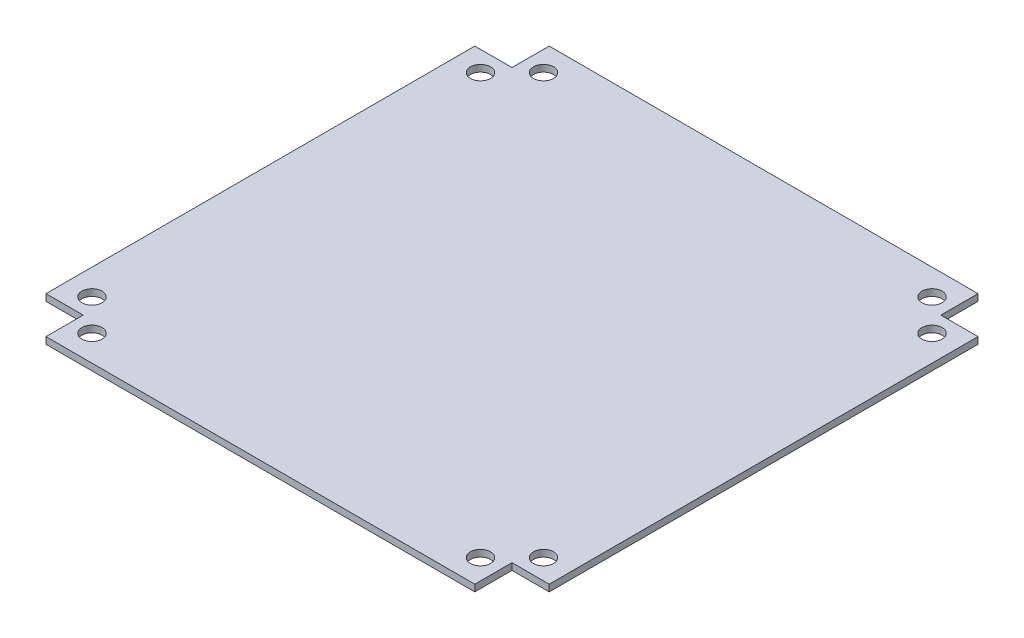
from build123d import *

# Parameters (mm, degrees)
BOSS_EXTRUDE1_DEPTH = 1.3
SKETCH2_R           = 1.95
CUT_EXTRUDE1_DEPTH  = 1.3


with BuildPart() as part:
    # Sketch1 → Boss-Extrude1 (new body)
    with BuildSketch(Plane(origin=(0, 0, 0), x_dir=(1, 0, 0), z_dir=(0, 1, 0))):
        Polygon((7.2, 7.2), (7.2, 0), (90.2, 0), (90.2, 7.2), (97.4, 7.2), (97.4, 90.2), (90.2, 90.2), (90.2, 97.4), (7.2, 97.4), (7.2, 90.2), (0, 90.2), (0, 7.2), align=None)
    extrude(amount=BOSS_EXTRUDE1_DEPTH)

    # Sketch2 → Cut-Extrude1 (cut)
    with BuildSketch(Plane.XZ):
        with Locations((92.4, -86.3)):
            Circle(SKETCH2_R)
        with Locations((86.3, -92.4)):
            Circle(SKETCH2_R)
        with Locations((11.1, -92.4)):
            Circle(SKETCH2_R)
        with Locations((5, -86.3)):
            Circle(SKETCH2_R)
        with Locations((5, -11.1)):
            Circle(SKETCH2_R)
        with Locations((11.1, -5)):
            Circle(SKETCH2_R)
        with Locations((86.3, -5)):
            Circle(SKETCH2_R)
        with Locations((92.4, -11.1)):
            Circle(SKETCH2_R)
    extrude(amount=-CUT_EXTRUDE1_DEPTH, mode=Mode.SUBTRACT)


solid = part.part
